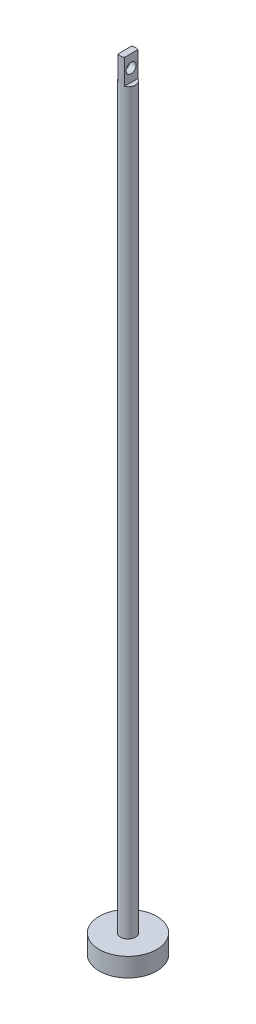
from build123d import *

# Parameters (mm, degrees)
SKETCH_1_R           = 23
EXTRUDE_1_DEPTH      = 15
SKETCH_2_R           = 6
EXTRUDE_2_DEPTH      = 610
SKETCH_3_OUTSIDE_W   = 173.676
SKETCH_3_OUTSIDE_H   = 173.676
SKETCH_3_OUTSIDE_W_2 = 5
SKETCH_3_OUTSIDE_H_2 = 20
CUT_EXTRUDE_1_DEPTH  = 20
SKETCH_4_R           = 4
CUT_EXTRUDE_2_DEPTH  = 20


with BuildPart() as part:
    # 草图1 → 凸台-拉伸1 (new body)
    with BuildSketch(Plane(origin=(0, 0, 0), x_dir=(1, 0, 0), z_dir=(0, 1, 0))):
        Circle(SKETCH_1_R)
    extrude(amount=EXTRUDE_1_DEPTH)

    # 草图2 → 凸台-拉伸2 (add)
    with BuildSketch(Plane(origin=(0, 15, 0), x_dir=(1, 0, 0), z_dir=(0, 1, 0))):
        Circle(SKETCH_2_R)
    extrude(amount=EXTRUDE_2_DEPTH)

    # 草图3 outside → 切除-拉伸1 (cut)
    with BuildSketch(Plane(origin=(0, 625, 0), x_dir=(1, 0, 0), z_dir=(0, 1, 0))):
        Rectangle(SKETCH_3_OUTSIDE_W, SKETCH_3_OUTSIDE_H)
        Rectangle(SKETCH_3_OUTSIDE_W_2, SKETCH_3_OUTSIDE_H_2, mode=Mode.SUBTRACT)
    extrude(amount=-CUT_EXTRUDE_1_DEPTH, mode=Mode.SUBTRACT)

    # 草图4 → 切除-拉伸2 (cut)
    with BuildSketch(Plane.ZY.offset(2.5)):
        with Locations((0, 615)):
            Circle(SKETCH_4_R)
    extrude(amount=-CUT_EXTRUDE_2_DEPTH, mode=Mode.SUBTRACT)


solid = part.part
